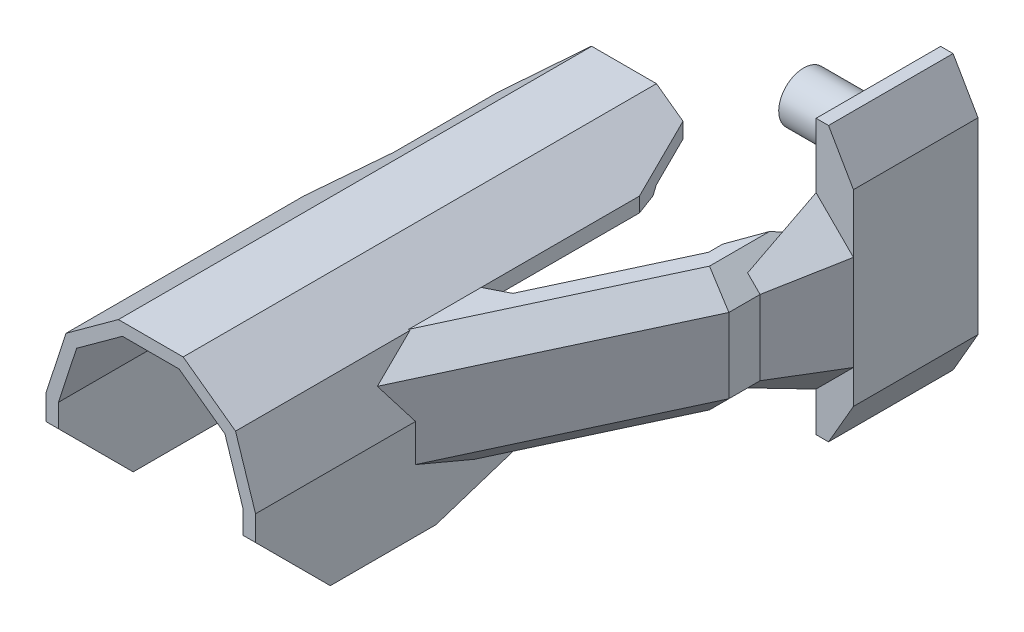
from build123d import *
from OCP.BRepFilletAPI import BRepFilletAPI_MakeChamfer

# Parameters (mm, degrees)
BOSS_EXTRU_1_DEPTH      = 200
BOSS_EXTRU_2_DEPTH      = 50
BOSS_EXTRU_2_DEPTH_BACK = 90
ESQUISSE3_W             = 40
ESQUISSE3_H             = 110
BOSS_EXTRU_3_DEPTH      = 150
CHANFREIN1_SIZE         = 10
CHANFREIN1_SIZE2        = 17.320508076
CHANFREIN2_SIZE         = 100
CHANFREIN2_SIZE2        = 46.630765816
CHANFREIN3_SIZE         = 10
CHANFREIN4_SIZE         = 30
BOSS_EXTRU_4_DEPTH      = 10
ENL_V_MAT_EXTRU_1_DEPTH = 130
ESQUISSE7_R             = 10
BOSS_EXTRU_5_DEPTH      = 30
CHANFREIN5_SIZE         = 27.474774195
CHANFREIN5_SIZE_2       = 10
ENL_V_MAT_EXTRU_2_DEPTH = 130
CHANFREIN6_SIZE         = 10
CHANFREIN6_SIZE_2       = 27.474774195
CHANFREIN6_SIZE_3       = 9.402654051


# Some blends are built 0.0001 mm under size
with BuildPart() as part:
    # Esquisse1 → Boss.-Extru.1 (new body)
    with BuildSketch(Plane.XY):
        Polygon((-42.05848897, 40), (-42.05848897, 0), (-37.05848897, 0), (-37.05848897, 5), (-37.05848897, 39.208077798), (-29.772778292, 61.631189606), (-11.372189368, 75), (11.372189368, 75), (29.772778292, 61.631189606), (37.05848897, 39.208077798), (37.05848897, 5), (37.05848897, 0), (42.05848897, 0), (42.05848897, 40), (34.026032334, 64.72135955), (12.996787849, 80), (-12.996787849, 80), (-34.026032334, 64.72135955), align=None)
    extrude(amount=BOSS_EXTRU_1_DEPTH)

    # Esquisse3 → Boss.-Extru.2 (add, two sides: drawn at the far end of the back side and taken through both)
    with BuildSketch(Plane(origin=(42.05848897, 0, 0), x_dir=(0, 0, -1), z_dir=(1, 0, 0)).offset(-BOSS_EXTRU_2_DEPTH_BACK)):
        with Locations((20, 45)):
            Rectangle(ESQUISSE3_W, ESQUISSE3_H)
    extrude(amount=BOSS_EXTRU_2_DEPTH + BOSS_EXTRU_2_DEPTH_BACK)

    # Esquisse4 → Boss.-Extru.3 (add)
    with BuildSketch(Plane.XY):
        Polygon((42.05848897, 40), (42.05848897, 15), (82.05848897, 15), (82.05848897, 65), (33.642516656, 65), (34.026032334, 64.72135955), align=None)
    extrude(amount=BOSS_EXTRU_3_DEPTH)

    # Chanfrein1: one chamfer whose edges measure the first distance from different faces: ONE call of the kernel's chamfer builder (chamfer() names one face for all edges)
    chanfrein1_edges_1 = [part.edges().sort_by_distance(p)[0] for p in [
        (92.05848897, -10, -20),
    ]]
    chanfrein1_side_1 = [part.faces().sort_by_distance(p)[0] for p in [
        (22.05848897, -10, -20),
    ]]
    chanfrein1_edges_2 = [part.edges().sort_by_distance(p)[0] for p in [
        (92.05848897, 100, -20),
    ]]
    chanfrein1_side_2 = [part.faces().sort_by_distance(p)[0] for p in [
        (22.05848897, 100, -20),
    ]]
    chanfrein1 = BRepFilletAPI_MakeChamfer(part.part.solid().wrapped)
    for e in chanfrein1_edges_1:
        chanfrein1.Add(CHANFREIN1_SIZE, CHANFREIN1_SIZE2, e.wrapped, chanfrein1_side_1[0].wrapped)  # the first distance lies on this face
    for e in chanfrein1_edges_2:
        chanfrein1.Add(CHANFREIN1_SIZE, CHANFREIN1_SIZE2, e.wrapped, chanfrein1_side_2[0].wrapped)  # the first distance lies on this face
    add(Compound.cast(chanfrein1.Shape()), mode=Mode.REPLACE)

    # Chanfrein2
    chanfrein2_edges = [part.edges().sort_by_distance(p)[0] for p in [
        (82.05848897, 40, 150),
    ]]
    chanfrein2_side = [part.faces().sort_by_distance(p)[0] for p in [
        (82.05848897, 40, 75),
    ]]
    chamfer(chanfrein2_edges, length=CHANFREIN2_SIZE, length2=CHANFREIN2_SIZE2, reference=chanfrein2_side[0])

    # Chanfrein3
    # the kernel refuses this chamfer: 10 mm, written as the material it takes off along each edge
    with BuildSketch(Plane(origin=(92.926890911, 15, 26.692636822), x_dir=(0.02491972708357348, 0.9996219169112968, 0.011620259578202877), z_dir=(-0.4226182617407005, 0, 0.9063077870366495))) as chanfrein3_piece_1_section:
        Polygon((CHANFREIN3_SIZE * 0.999621916911, CHANFREIN3_SIZE * 0.0274958766106), (-CHANFREIN3_SIZE * 0.0274958766106, CHANFREIN3_SIZE * 0.999621916911), (0, 0), align=None)
    chanfrein3_piece_1 = extrude(amount=146.081723085, mode=Mode.PRIVATE)
    chanfrein3_piece_1 = split(chanfrein3_piece_1, bisect_by=Plane(origin=(42.05848897, 18.333333333, 85.0027998), z_dir=(1, 0, 0)), keep=Keep.TOP, mode=Mode.PRIVATE)
    add(chanfrein3_piece_1, mode=Mode.SUBTRACT)
    with BuildSketch(Plane(origin=(82.05848897, 15, 0), x_dir=(0.027495876610586334, 0.9996219169112968, 0), z_dir=(0, 0, 1)), Plane(origin=(82.05848897, 65, 0), x_dir=(-0.9996219169112968, 0.027495876610586317, 0), z_dir=(0, 0, 1))) as chanfrein3_piece_2:
        Polygon((CHANFREIN3_SIZE * 0.999621916911, CHANFREIN3_SIZE * 0.0274958766106), (-CHANFREIN3_SIZE * 0.0274958766106, CHANFREIN3_SIZE * 0.999621916911), (0, 0), align=None)
    extrude(amount=75.71682988, mode=Mode.SUBTRACT)
    with BuildSketch(Plane(origin=(61.144553034, 65, 150), x_dir=(0, 0.027495876610586282, -0.9996219169112968), z_dir=(-1, 0, 0))) as chanfrein3_piece_3_section:
        Polygon((CHANFREIN3_SIZE * 0.999621916911, CHANFREIN3_SIZE * 0.0274958766106), (-CHANFREIN3_SIZE * 0.0274958766106, CHANFREIN3_SIZE * 0.999621916911), (0, 0), align=None)
    chanfrein3_piece_3 = extrude(amount=53.218866257, mode=Mode.PRIVATE)
    chanfrein3_piece_3 = split(chanfrein3_piece_3, bisect_by=Plane(origin=(34.447587874, 63.423945004, 144.130905286), z_dir=(0.9510565162951539, 0.3090169943749468, 0)), keep=Keep.TOP, mode=Mode.PRIVATE)
    add(chanfrein3_piece_3, mode=Mode.SUBTRACT)
    with BuildSketch(Plane(origin=(61.144553034, 65, 150), x_dir=(0, 0.027495876610586282, -0.9996219169112968), z_dir=(-1, 0, 0))) as chanfrein3_piece_4_section:
        Polygon((CHANFREIN3_SIZE * 0.999621916911, CHANFREIN3_SIZE * 0.0274958766106), (-CHANFREIN3_SIZE * 0.0274958766106, CHANFREIN3_SIZE * 0.999621916911), (0, 0), align=None)
    chanfrein3_piece_4 = extrude(amount=53.218866257, mode=Mode.PRIVATE)
    chanfrein3_piece_4 = split(chanfrein3_piece_4, bisect_by=Plane(origin=(33.833825058, 64.86100631, 145.046222385), z_dir=(0.5877852522924745, 0.8090169943749465, 0)), keep=Keep.TOP, mode=Mode.PRIVATE)
    add(chanfrein3_piece_4, mode=Mode.SUBTRACT)
    with BuildSketch(Plane(origin=(92.926890911, 65, 26.692636822), x_dir=(-0.9059651273892109, 0.027495876610586337, -0.4224584769229591), z_dir=(-0.4226182617407005, 0, 0.9063077870366495))) as chanfrein3_piece_5_section:
        Polygon((CHANFREIN3_SIZE * 0.999621916911, CHANFREIN3_SIZE * 0.0274958766106), (-CHANFREIN3_SIZE * 0.0274958766106, CHANFREIN3_SIZE * 0.999621916911), (0, 0), align=None)
    chanfrein3_piece_5 = extrude(amount=161.771451656, mode=Mode.PRIVATE)
    chanfrein3_piece_5 = split(chanfrein3_piece_5, bisect_by=Plane(origin=(37.356602315, 54.470919151, 89.132837903), z_dir=(0.9510565162951539, 0.3090169943749468, 0)), keep=Keep.TOP, mode=Mode.PRIVATE)
    add(chanfrein3_piece_5, mode=Mode.SUBTRACT)
    with BuildSketch(Plane(origin=(92.926890911, 65, 26.692636822), x_dir=(-0.9059651273892109, 0.027495876610586337, -0.4224584769229591), z_dir=(-0.4226182617407005, 0, 0.9063077870366495))) as chanfrein3_piece_6_section:
        Polygon((CHANFREIN3_SIZE * 0.999621916911, CHANFREIN3_SIZE * 0.0274958766106), (-CHANFREIN3_SIZE * 0.0274958766106, CHANFREIN3_SIZE * 0.999621916911), (0, 0), align=None)
    chanfrein3_piece_6 = extrude(amount=161.771451656, mode=Mode.PRIVATE)
    chanfrein3_piece_6 = split(chanfrein3_piece_6, bisect_by=Plane(origin=(33.834404205, 64.860585536, 139.950840197), z_dir=(0.5877852522924745, 0.8090169943749465, 0)), keep=Keep.TOP, mode=Mode.PRIVATE)
    add(chanfrein3_piece_6, mode=Mode.SUBTRACT)

    # Chanfrein4
    chanfrein4_edges = [part.edges().sort_by_distance(p)[0] for p in [
        (-39.55848897, 0, 200),
        (39.55848897, 0, 200),
    ]]
    chamfer(chanfrein4_edges, length=CHANFREIN4_SIZE)

    # Esquisse6 → Boss.-Extru.4 (add)
    with BuildSketch(Plane.XY):
        Polygon((-47.94151103, -10), (82.05848897, -10), (92.05848897, 7.320508076), (92.05848897, 82.679491924), (82.05848897, 100), (-47.94151103, 100), align=None)
    extrude(amount=BOSS_EXTRU_4_DEPTH)

    # Esquisse5 → Enlèv. mat.-Extru.1 (cut)
    with BuildSketch(Plane(origin=(0, 100, 0), x_dir=(1, 0, 0), z_dir=(0, 1, 0))):
        Polygon((77.05848897, -10), (77.05848897, 40), (-47.94151103, 40), (-47.94151103, -10), (33.642516656, -10), (67.05848897, -10), align=None)
        Polygon((67.05848897, -43.145928791), (67.05848897, -10), (33.642516656, -10), (33.642516656, -101.029300724), (42.077832628, -96.717119194), align=None)
    extrude(amount=-ENL_V_MAT_EXTRU_1_DEPTH, mode=Mode.SUBTRACT)

    # Esquisse7 → Boss.-Extru.5 (add)
    with BuildSketch(Plane.ZY.offset(-77.05848897)):
        with Locations(Location((-15, 80, 0), (0, 0, 270))):
            Circle(ESQUISSE7_R)
    extrude(amount=BOSS_EXTRU_5_DEPTH)

    # Chanfrein5
    chanfrein5_edges_1 = [part.edges().sort_by_distance(p)[0] for p in [
        (79.55848897, 22.5, 10),
    ]]
    chanfrein5_side_1 = [part.faces().sort_by_distance(p)[0] for p in [
        (79.55848897, 22.5, 10.2),
    ]]
    chanfrein5_edges_2 = [part.edges().sort_by_distance(p)[0] for p in [
        (82.05848897, 40, 10),
    ]]
    chanfrein5_side_2 = [part.faces().sort_by_distance(p)[0] for p in [
        (82.05848897, 40, 10.2),
    ]]
    chanfrein5_edges_3 = [part.edges().sort_by_distance(p)[0] for p in [
        (79.55848897, 57.5, 10),
    ]]
    chanfrein5_side_3 = [part.faces().sort_by_distance(p)[0] for p in [
        (79.55848897, 57.5, 10.2),
    ]]
    chanfrein5_edges_4 = [part.edges().sort_by_distance(p)[0] for p in [
        (67.05848897, 40, 10),
    ]]
    chanfrein5_side_4 = [part.faces().sort_by_distance(p)[0] for p in [
        (67.25848897, 40, 10),
    ]]
    chanfrein5 = BRepFilletAPI_MakeChamfer(part.part.solid().wrapped)
    for e in chanfrein5_edges_1:
        chanfrein5.Add(CHANFREIN5_SIZE - 0.0001, CHANFREIN5_SIZE_2 - 0.0001, e.wrapped, chanfrein5_side_1[0].wrapped)
    for e in chanfrein5_edges_2:
        chanfrein5.Add(CHANFREIN5_SIZE - 0.0001, CHANFREIN5_SIZE_2 - 0.0001, e.wrapped, chanfrein5_side_2[0].wrapped)
    for e in chanfrein5_edges_3:
        chanfrein5.Add(CHANFREIN5_SIZE - 0.0001, CHANFREIN5_SIZE_2 - 0.0001, e.wrapped, chanfrein5_side_3[0].wrapped)
    for e in chanfrein5_edges_4:
        chanfrein5.Add(CHANFREIN5_SIZE_2 - 0.0001, CHANFREIN5_SIZE - 0.0001, e.wrapped, chanfrein5_side_4[0].wrapped)
    add(Compound.cast(chanfrein5.Shape()), mode=Mode.REPLACE)  # a hair under: the kernel refuses the full size

    # Esquisse8 → Enlèv. mat.-Extru.2 (cut)
    with BuildSketch(Plane(origin=(0, 0, 0), x_dir=(1, 0, 0), z_dir=(0, 1, 0))):
        Polygon((-23.511410092, -10), (-23.511410092, -78.891987617), (-42.05848897, -124.008670609), (-42.05848897, -10), align=None)
    extrude(amount=ENL_V_MAT_EXTRU_2_DEPTH, mode=Mode.SUBTRACT)

    # Chanfrein6
    # the kernel refuses this chamfer: 27.474774195, 10, 9.402654051 mm, written as the material it takes off along each edge
    with BuildSketch(Plane(origin=(-23.511410092, -5.094574606, 10), x_dir=(0.9950833631817486, 0, -0.09904090225205081), z_dir=(0, 1, 0))) as chanfrein6_piece_1:
        Polygon((CHANFREIN6_SIZE * 0.995083363182, -CHANFREIN6_SIZE * 0.0990409022521), (-CHANFREIN6_SIZE_2 * 0.0990409022504, -CHANFREIN6_SIZE_2 * 0.995083363165), (0, 0), align=None)
    extrude(amount=148.730168875, mode=Mode.SUBTRACT)
    with BuildSketch(Plane(origin=(33.642516656, 136.274914494, 10), x_dir=(0.01318405819864584, 0, 0.9999130865277315), z_dir=(0, -1, 0))) as chanfrein6_piece_2:
        Polygon((CHANFREIN6_SIZE_2 * 0.999913086511, CHANFREIN6_SIZE_2 * 0.0131840581984), (-CHANFREIN6_SIZE * 0.0131840581986, CHANFREIN6_SIZE * 0.999913086528), (0, 0), align=None)
    extrude(amount=157.828469437, mode=Mode.SUBTRACT)
    with BuildSketch(Plane(origin=(-26.404734257, 0, 131.72579712), x_dir=(-0.04508122292734055, 0.9950833631817486, -0.08818607406090614), z_dir=(0.8904005522534487, -1.452228809103749e-15, -0.455177829586145))) as chanfrein6_piece_3:
        Polygon((CHANFREIN6_SIZE * 0.995083363182, CHANFREIN6_SIZE * 0.0990409022521), (-CHANFREIN6_SIZE_2 * 0.0990409022504, CHANFREIN6_SIZE_2 * 0.995083363165), (0, 0), align=None)
    extrude(amount=148.165279233, mode=Mode.SUBTRACT)
    # the kernel refuses this chamfer: 27.474774195, 10, 9.402654051 mm, written as the material it takes off along each edge
    with BuildSketch(Plane(origin=(33.642516656, 49.72135955, 12.11533794), x_dir=(-0.34404612147903313, 0.9389527497671193, 0), z_dir=(0, 0, 1))) as chanfrein6_2_piece_1_section:
        Polygon((CHANFREIN6_SIZE * 0.999313229545, -CHANFREIN6_SIZE * 0.0370549491456), (CHANFREIN6_SIZE_3 * 0.938952749733, -CHANFREIN6_SIZE_3 * 0.344046121466), (0, 0), align=None)
    chanfrein6_2_piece_1 = extrude(amount=114.273399039, mode=Mode.PRIVATE)
    chanfrein6_2_piece_1 = split(chanfrein6_2_piece_1, bisect_by=Plane(origin=(50.743372859, 55.917594233, 92.287245712), z_dir=(-0.455177829586145, 0, -0.8904005522534487)), keep=Keep.TOP, mode=Mode.PRIVATE)
    add(chanfrein6_2_piece_1, mode=Mode.SUBTRACT)


solid = part.part
